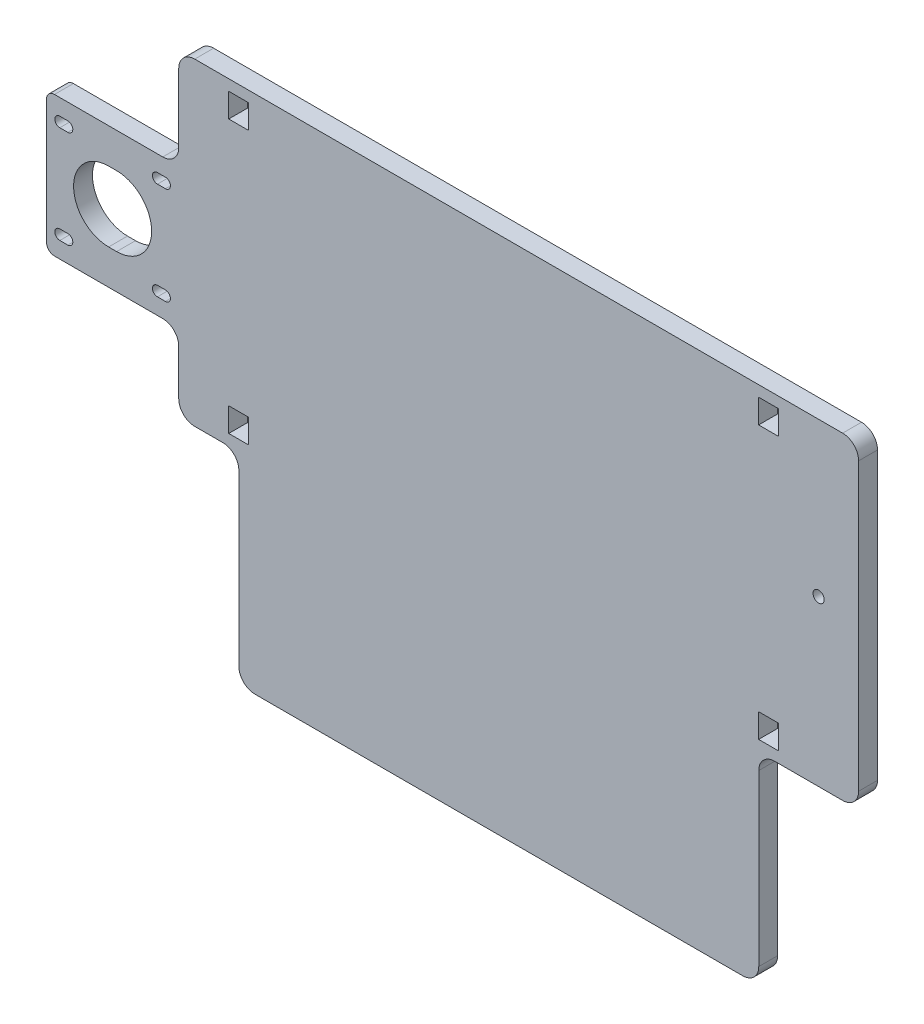
from build123d import *

# Parameters (mm, degrees)
SKETCH1_W           = 257.9
SKETCH1_H           = 165.1
SKETCH1_W_2         = 6.35
SKETCH1_H_2         = 7.62
BOSS_EXTRUDE1_DEPTH = 6
SKETCH2_R           = 1.778
CUT_EXTRUDE1_DEPTH  = 307.278337464
SKETCH3_W           = 42
SKETCH3_H           = 31.9913
SKETCH3_W_2         = 31.713
SKETCH3_H_2         = 64.0842
CUT_EXTRUDE2_DEPTH  = 307.278337464
FILLET1_R           = 5.08
FILLET2_R           = 2.54


with BuildPart() as part:
    # Sketch1 → Boss-Extrude1 (new body)
    with BuildSketch(Plane.XY):
        with Locations((128.95, 82.55)):
            Rectangle(SKETCH1_W, SKETCH1_H)
        with Locations((229.325, 157.8356)):
            Rectangle(SKETCH1_W_2, SKETCH1_H_2, mode=Mode.SUBTRACT)
        with Locations((61.05, 157.8356)):
            Rectangle(SKETCH1_W_2, SKETCH1_H_2, mode=Mode.SUBTRACT)
        with Locations((229.325, 71.3486)):
            Rectangle(SKETCH1_W_2, SKETCH1_H_2, mode=Mode.SUBTRACT)
        with Locations((61.05, 71.3486)):
            Rectangle(SKETCH1_W_2, SKETCH1_H_2, mode=Mode.SUBTRACT)
    extrude(amount=BOSS_EXTRUDE1_DEPTH)

    # Sketch2 → Cut-Extrude1 (cut, through all)
    with BuildSketch(Plane.XY.offset(6)):
        with Locations((245.2, 116.3447)):
            Circle(SKETCH2_R)
        with BuildLine():
            Line((4.23, 127.9712), (6.77, 127.9712))
            ThreePointArc((6.77, 127.9712), (8.3575, 126.3837), (6.77, 124.7962))
            Line((6.77, 124.7962), (4.23, 124.7962))
            ThreePointArc((4.23, 124.7962), (2.6425, 126.3837), (4.23, 127.9712))
        make_face()
        with BuildLine():
            Line((35.23, 127.9712), (37.77, 127.9712))
            ThreePointArc((37.77, 127.9712), (39.3575, 126.3837), (37.77, 124.7962))
            Line((37.77, 124.7962), (35.23, 124.7962))
            ThreePointArc((35.23, 124.7962), (33.6425, 126.3837), (35.23, 127.9712))
        make_face()
        with BuildLine():
            Line((35.23, 96.9712), (37.77, 96.9712))
            ThreePointArc((37.77, 96.9712), (39.3575, 95.3837), (37.77, 93.7962))
            Line((37.77, 93.7962), (35.23, 93.7962))
            ThreePointArc((35.23, 93.7962), (33.6425, 95.3837), (35.23, 96.9712))
        make_face()
        with BuildLine():
            Line((4.23, 96.9712), (6.77, 96.9712))
            ThreePointArc((6.77, 96.9712), (8.3575, 95.3837), (6.77, 93.7962))
            Line((6.77, 93.7962), (4.23, 93.7962))
            ThreePointArc((4.23, 93.7962), (2.6425, 95.3837), (4.23, 96.9712))
        make_face()
        with BuildLine():
            Line((19.73, 122.0087), (22.27, 122.0087))
            ThreePointArc((22.27, 122.0087), (33.395, 110.8837), (22.27, 99.7587))
            Line((22.27, 99.7587), (19.73, 99.7587))
            ThreePointArc((19.73, 99.7587), (8.605, 110.8837), (19.73, 122.0087))
        make_face()
    extrude(amount=-CUT_EXTRUDE1_DEPTH, mode=Mode.SUBTRACT)

    # Sketch3 → Cut-Extrude2 (cut, through all)
    with BuildSketch(Plane.XY.offset(6)):
        Polygon((61.087, 0), (61.087, 64.0842), (42, 64.0842), (42, 88.6587), (0, 88.6587), (0, 0), align=None)
        with Locations((21, 149.10435)):
            Rectangle(SKETCH3_W, SKETCH3_H)
        with Locations((242.0435, 32.0421)):
            Rectangle(SKETCH3_W_2, SKETCH3_H_2)
    extrude(amount=-CUT_EXTRUDE2_DEPTH, mode=Mode.SUBTRACT)

    # Fillet1
    fillet1_edges = [part.edges().sort_by_distance(p)[0] for p in [
        (42, 133.1087, 3),
        (42, 88.6587, 3),
        (61.087, 64.0842, 3),
        (226.187, 64.0842, 3),
        (257.9, 64.0842, 3),
        (226.187, 0, 3),
        (61.087, 0, 3),
        (42, 64.0842, 3),
        (257.9, 165.1, 3),
        (42, 165.1, 3),
    ]]
    fillet(fillet1_edges, radius=FILLET1_R)

    # Fillet2
    fillet2_edges = [part.edges().sort_by_distance(p)[0] for p in [
        (0, 88.6587, 3),
        (0, 133.1087, 3),
    ]]
    fillet(fillet2_edges, radius=FILLET2_R)


solid = part.part
